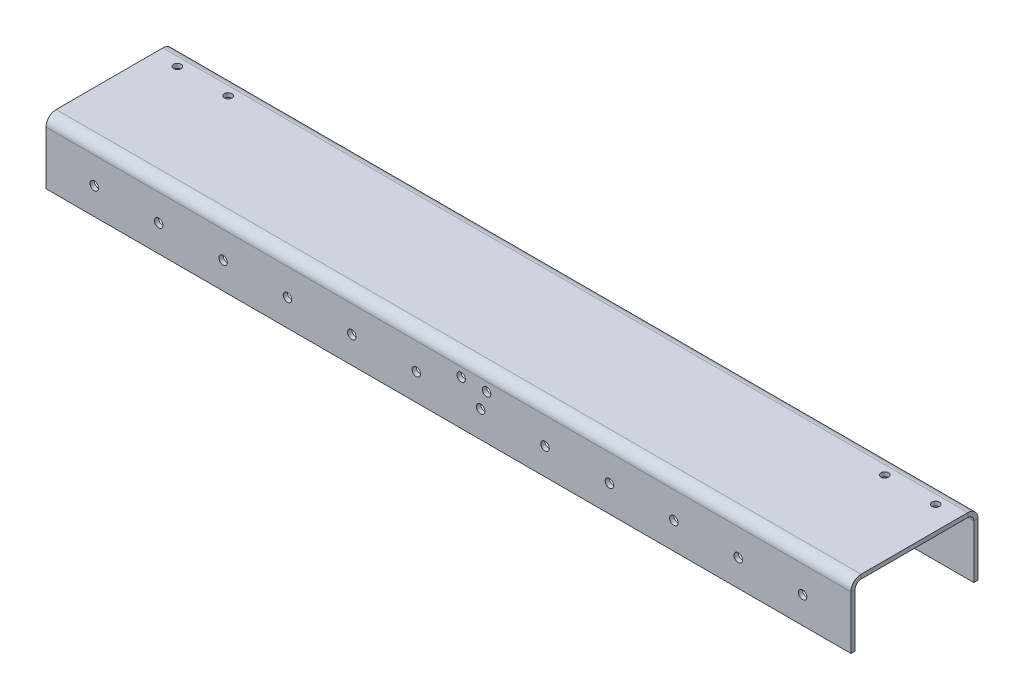
from build123d import *

# Parameters (mm, degrees)
SKETCH1_W                      = 1900
SKETCH1_H                      = 300
BASE_FLANGE1_DEPTH             = 10
EDGE_FLANGE1_STRIP_W           = 68
EDGE_FLANGE1_STRIP_H           = 10
EDGE_FLANGE1_STRIP_CUT_DEPTH   = 1900
EDGE_FLANGE1_STRIP_2_W         = 68
EDGE_FLANGE1_STRIP_2_H         = 10
EDGE_FLANGE1_STRIP_CUT_2_DEPTH = 1900
EDGE_FLANGE1_DEPTH             = 1900
EDGE_FLANGE1_BEND_DEPTH        = 1900
SKETCH14_R                     = 10
CUT_EXTRUDE1_DEPTH             = 1008.47208398
LPATTERN1_COUNT                = 12
LPATTERN1_PITCH                = 152
SKETCH16_R                     = 10
CUT_EXTRUDE2_DEPTH             = 1008.47208398
SKETCH17_R                     = 9
CUT_EXTRUDE3_DEPTH             = 974.396116697


# Sheet-metal steps are written as plain solids
with BuildPart() as part:
    # Sketch1 → Base-Flange1 (new body)
    with BuildSketch(Plane(origin=(0, 0, 0), x_dir=(1, 0, 0), z_dir=(0, 1, 0))):
        Rectangle(SKETCH1_W, SKETCH1_H)
    extrude(amount=-BASE_FLANGE1_DEPTH)

    # Edge-Flange1 strip (across the edge) → Edge-Flange1 strip cut (cut)
    with BuildSketch(Plane(origin=(950, -10, 150), x_dir=(0, 0, -1), z_dir=(-1, 0, 0))):
        with Locations((-10, -5)):
            Rectangle(EDGE_FLANGE1_STRIP_W, EDGE_FLANGE1_STRIP_H)
    extrude(amount=EDGE_FLANGE1_STRIP_CUT_DEPTH, mode=Mode.SUBTRACT)

    # Edge-Flange1 strip 2 (across the edge) → Edge-Flange1 strip cut 2 (cut)
    with BuildSketch(Plane(origin=(-950, -10, -150), x_dir=(0, 0, 1), z_dir=(1, 0, 0))):
        with Locations((-10, -5)):
            Rectangle(EDGE_FLANGE1_STRIP_2_W, EDGE_FLANGE1_STRIP_2_H)
    extrude(amount=EDGE_FLANGE1_STRIP_CUT_2_DEPTH, mode=Mode.SUBTRACT)

    # Edge-Flange1 section (across the edge) → Edge-Flange1 (add)
    with BuildSketch(Plane(origin=(950, -10, 150), x_dir=(0, 0, -1), z_dir=(-1, 0, 0))):
        with BuildLine():
            Line((0, 14), (0, 140))
            Line((0, 140), (10, 140))
            Line((10, 140), (10, 14))
            ThreePointArc((10, 14), (14.100505063, 4.100505063), (24, 0))
            Line((24, 0), (24, -10))
            ThreePointArc((24, -10), (7.029437252, -2.970562748), (0, 14))
        make_face()
    extrude(amount=EDGE_FLANGE1_DEPTH)

    # Edge-Flange1 section 2 (across the edge) → Edge-Flange1 bend (add)
    with BuildSketch(Plane(origin=(-950, -10, -150), x_dir=(0, 0, 1), z_dir=(1, 0, 0))):
        with BuildLine():
            Line((0, 14), (0, 140))
            Line((0, 140), (10, 140))
            Line((10, 140), (10, 14))
            ThreePointArc((10, 14), (14.100505063, 4.100505063), (24, 0))
            Line((24, 0), (24, -10))
            ThreePointArc((24, -10), (7.029437252, -2.970562748), (0, 14))
        make_face()
    extrude(amount=EDGE_FLANGE1_BEND_DEPTH)

    # Sketch14 → Cut-Extrude1 (cut, through all)
    with BuildSketch(Plane.XY.offset(150)):
        with Locations((-836, -87)):
            Circle(SKETCH14_R)
    cut_extrude1 = extrude(amount=-CUT_EXTRUDE1_DEPTH, mode=Mode.SUBTRACT)

    # LPattern1: Cut-Extrude1 ×12
    with Locations(*[(i * LPATTERN1_PITCH, 0, 0) for i in range(1, LPATTERN1_COUNT)]):
        add(cut_extrude1, mode=Mode.SUBTRACT)

    # Sketch16 → Cut-Extrude2 (cut, through all)
    with BuildSketch(Plane.XY.offset(150)):
        with Locations((30, -45)):
            Circle(SKETCH16_R)
        with Locations((90, -45)):
            Circle(SKETCH16_R)
    extrude(amount=-CUT_EXTRUDE2_DEPTH, mode=Mode.SUBTRACT)

    # Sketch17 → Cut-Extrude3 (cut, through all)
    with BuildSketch(Plane(origin=(0, 0, 0), x_dir=(1, 0, 0), z_dir=(0, 1, 0))):
        with Locations(Location((775, 105, 0), (0, 0, 270))):
            Circle(SKETCH17_R)
        with Locations(Location((895, 105, 0), (0, 0, 270))):
            Circle(SKETCH17_R)
    cut_extrude3 = extrude(amount=-CUT_EXTRUDE3_DEPTH, mode=Mode.SUBTRACT)

    # Mirror1: Cut-Extrude3 across plane
    add(cut_extrude3.mirror(Plane(origin=(0, 0, 0), x_dir=(0, 0, 1), z_dir=(1, 0, 0))), mode=Mode.SUBTRACT)


solid = part.part
